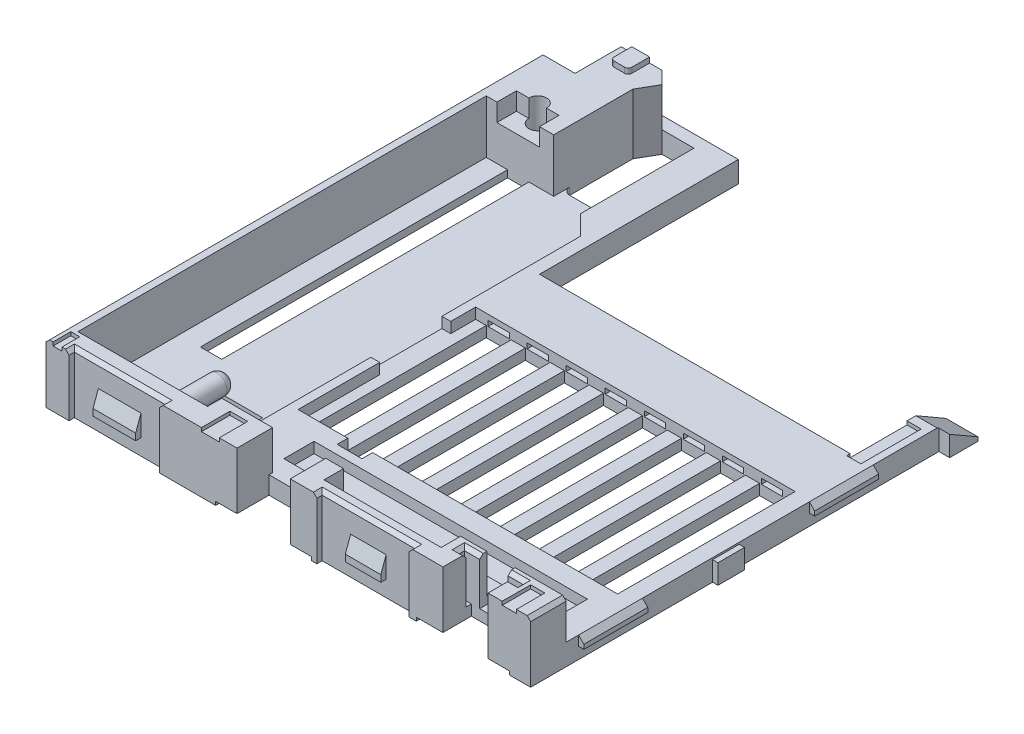
from build123d import *

# Parameters (mm, degrees)
SKETCH1_W                = 13.65
SKETCH1_H                = 15.2
BOSS_EXTRUDE1_DEPTH      = 1.7
CUT_EXTRUDE1_OUTLINE_W   = 1.5
CUT_EXTRUDE1_OUTLINE_H   = 0.9
CUT_EXTRUDE1_OUTLINE_W_2 = 1.27
CUT_EXTRUDE1_OUTLINE_H_2 = 0.8
CUT_EXTRUDE1_OUTLINE_W_3 = 0.9
CUT_EXTRUDE1_OUTLINE_H_3 = 1.3
CUT_EXTRUDE1_OUTLINE_W_4 = 1.4
CUT_EXTRUDE1_OUTLINE_H_4 = 2
CUT_EXTRUDE1_OUTLINE_W_5 = 0.6
CUT_EXTRUDE1_OUTLINE_H_5 = 8.65
CUT_EXTRUDE1_OUTLINE_R   = 0.25
CUT_EXTRUDE1_OUTLINE_W_6 = 0.7
CUT_EXTRUDE1_OUTLINE_H_6 = 5
CUT_EXTRUDE1_OUTLINE_H_7 = 5.3
CUT_EXTRUDE1_DEPTH       = 1.7
SKETCH3_W                = 2.55
SKETCH3_H                = 1.7
CUT_EXTRUDE2_DEPTH       = 0.15
SKETCH4_W                = 2.6
SKETCH4_H                = 1.7
CUT_EXTRUDE3_DEPTH       = 0.15
SKETCH5_W                = 2.7
SKETCH5_H                = 1.4
SKETCH5_W_2              = 2.62
SKETCH5_W_3              = 2.6
SKETCH5_H_2              = 0.95
CUT_EXTRUDE4_DEPTH       = 0.1
SKETCH6_W                = 1
SKETCH6_H                = 0.95
CUT_EXTRUDE5_DEPTH       = 0.2
SKETCH7_W                = 1.9
SKETCH7_H                = 1.8
CUT_EXTRUDE6_DEPTH       = 0.1
SKETCH8_W                = 0.5
SKETCH8_H                = 1.2
CUT_EXTRUDE7_DEPTH       = 1
CUT_EXTRUDE8_DEPTH       = 1.5
CUT_EXTRUDE9_DEPTH       = 1.1
SKETCH11_W               = 9
SKETCH11_H               = 5
CUT_EXTRUDE10_DEPTH      = 0.3
SKETCH12_W               = 1.2
SKETCH12_H               = 0.55
CUT_EXTRUDE11_DEPTH      = 0.5
SKETCH14_W               = 7.7
SKETCH14_H               = 0.85
CUT_EXTRUDE12_DEPTH      = 0.3
SKETCH15_W               = 0.8
SKETCH15_H               = 0.7
CUT_EXTRUDE13_DEPTH      = 1.3
SKETCH16_W               = 1.65
SKETCH16_H               = 0.15
CUT_EXTRUDE14_DEPTH      = 1.3
SKETCH17_W               = 0.4
SKETCH17_H               = 0.8
CUT_EXTRUDE15_DEPTH      = 0.1
SKETCH18_W               = 0.5
SKETCH18_H               = 0.8
CUT_EXTRUDE16_DEPTH      = 0.1
SKETCH19_W               = 0.25
SKETCH19_H               = 0.5
CUT_EXTRUDE17_DEPTH      = 0.1
SKETCH20_W               = 3.3
SKETCH20_H               = 0.55
CUT_EXTRUDE18_DEPTH      = 0.8
SKETCH21_W               = 0.25
SKETCH21_H               = 2
CUT_EXTRUDE19_DEPTH      = 0.3
SKETCH22_W               = 0.4
SKETCH22_H               = 1.7
CUT_EXTRUDE20_DEPTH      = 0.1
SKETCH23_R               = 0.275
BOSS_EXTRUDE3_DEPTH      = 1.5
FILLET3_R                = 0.05
FILLET4_R                = 0.25
SKETCH24_W               = 0.9
SKETCH24_H               = 0.6
BOSS_EXTRUDE4_DEPTH      = 0.8
CHAMFER1_SIZE            = 0.85
CHAMFER1_SIZE2           = 0.490747729
SKETCH25_W               = 1
SKETCH25_H               = 0.6
BOSS_EXTRUDE5_DEPTH      = 0.15
DRAFT1_ANGLE             = 70
SKETCH26_W               = 1.2
SKETCH26_H               = 0.6
BOSS_EXTRUDE6_DEPTH      = 0.15
DRAFT6_ANGLE             = 70
SKETCH27_W               = 1.1
SKETCH27_H               = 0.65
SKETCH27_W_2             = 0.75
SKETCH27_H_2             = 0.6
BOSS_EXTRUDE7_DEPTH      = 0.15
DRAFT3_ANGLE             = 70
SKETCH29_W               = 1.8
SKETCH29_H               = 0.275
BOSS_EXTRUDE8_DEPTH      = 0.15
SKETCH29_W_2             = 0.75
SKETCH29_H_2             = 0.55
BOSS_EXTRUDE8_2_DEPTH    = 0.15
BOSS_EXTRUDE8_3_DEPTH    = 0.15
DRAFT4_ANGLE             = 45
DRAFT5_ANGLE             = 45
BOSS_EXTRUDE9_DEPTH      = 0.15
CHAMFER4_SIZE            = 0.1
SKETCH32_W               = 0.6
SKETCH32_H               = 0.15
CUT_EXTRUDE21_DEPTH      = 1.7
LPATTERN1_COUNT          = 8
LPATTERN1_PITCH          = 1.1


# Read off the part's stored shape, not the designer's step: Cut-Extrude1
with BuildPart() as part:
    # Sketch1 → Boss-Extrude1 (new body)
    with BuildSketch(Plane(origin=(0, 0, 0), x_dir=(1, 0, 0), z_dir=(0, 1, 0))):
        Rectangle(SKETCH1_W, SKETCH1_H)
    extrude(amount=BOSS_EXTRUDE1_DEPTH)

    # Cut-Extrude1 outline → Cut-Extrude1 (cut)
    with BuildSketch(Plane(origin=(0, 0, 0), x_dir=(1, 0, 0), z_dir=(0, 1, 0))):
        with Locations((-0.695, -7.15)):
            Rectangle(CUT_EXTRUDE1_OUTLINE_W, CUT_EXTRUDE1_OUTLINE_H)
        with Locations((4.99, -7.2)):
            Rectangle(CUT_EXTRUDE1_OUTLINE_W_2, CUT_EXTRUDE1_OUTLINE_H_2)
        with Locations((-6.375, 6.95)):
            Rectangle(CUT_EXTRUDE1_OUTLINE_W_3, CUT_EXTRUDE1_OUTLINE_H_3)
        Polygon((6.225, 3.9), (6.825, 3.9), (6.825, 7.6), (-2.525, 7.6), (-2.525, 2), (6.225, 2), align=None)
        with Locations((-4.025, -6)):
            Rectangle(CUT_EXTRUDE1_OUTLINE_W_4, CUT_EXTRUDE1_OUTLINE_H_4)
        with Locations((-5.625, 0.175)):
            Rectangle(CUT_EXTRUDE1_OUTLINE_W_5, CUT_EXTRUDE1_OUTLINE_H_5)
        with Locations((-5.625, 5.05)):
            Circle(CUT_EXTRUDE1_OUTLINE_R)
        with BuildLine():
            Line((-3.425, 4.95), (-3.425, 7.25))
            Line((-3.425, 7.25), (-4.325, 7.25))
            Line((-4.325, 7.25), (-4.625, 6.730384758))
            Line((-4.625, 6.730384758), (-4.625, 4.95))
            ThreePointArc((-4.625, 4.95), (-4.566421356, 4.808578644), (-4.425, 4.75))
            Line((-4.425, 4.75), (-3.625, 4.75))
            ThreePointArc((-3.625, 4.75), (-3.483578644, 4.808578644), (-3.425, 4.95))
        make_face()
        with Locations((5.725, -2.2)):
            Rectangle(CUT_EXTRUDE1_OUTLINE_W_6, CUT_EXTRUDE1_OUTLINE_H_6)
        with Locations((4.625, -2.2)):
            Rectangle(CUT_EXTRUDE1_OUTLINE_W_6, CUT_EXTRUDE1_OUTLINE_H_6)
        with Locations((-0.875, -2.35)):
            Rectangle(CUT_EXTRUDE1_OUTLINE_W_6, CUT_EXTRUDE1_OUTLINE_H_7)
        with Locations((3.525, -2.2)):
            Rectangle(CUT_EXTRUDE1_OUTLINE_W_6, CUT_EXTRUDE1_OUTLINE_H_6)
        with Locations((2.425, -2.2)):
            Rectangle(CUT_EXTRUDE1_OUTLINE_W_6, CUT_EXTRUDE1_OUTLINE_H_6)
        with Locations((1.325, -2.2)):
            Rectangle(CUT_EXTRUDE1_OUTLINE_W_6, CUT_EXTRUDE1_OUTLINE_H_6)
        with Locations((0.225, -2.2)):
            Rectangle(CUT_EXTRUDE1_OUTLINE_W_6, CUT_EXTRUDE1_OUTLINE_H_6)
        with Locations((-1.975, -2.2)):
            Rectangle(CUT_EXTRUDE1_OUTLINE_W_6, CUT_EXTRUDE1_OUTLINE_H_6)
    extrude(amount=CUT_EXTRUDE1_DEPTH, mode=Mode.SUBTRACT)

    # Sketch3 → Cut-Extrude2 (cut)
    with BuildSketch(Plane.XY.offset(7.6)):
        with Locations((-4.9, 0.85)):
            Rectangle(SKETCH3_W, SKETCH3_H)
    extrude(amount=-CUT_EXTRUDE2_DEPTH, mode=Mode.SUBTRACT)

    # Sketch4 → Cut-Extrude3 (cut)
    with BuildSketch(Plane.XY.offset(7.6)):
        with Locations((2.105, 0.85)):
            Rectangle(SKETCH4_W, SKETCH4_H)
    extrude(amount=-CUT_EXTRUDE3_DEPTH, mode=Mode.SUBTRACT)

    # Sketch5 → Cut-Extrude4 (cut)
    with BuildSketch(Plane.XZ):
        with Locations((-0.695, 6.9)):
            Rectangle(SKETCH5_W, SKETCH5_H)
        with Locations((4.915, 6.9)):
            Rectangle(SKETCH5_W_2, SKETCH5_H)
        with Locations((2.105, 6.675)):
            Rectangle(SKETCH5_W_3, SKETCH5_H_2)
    extrude(amount=-CUT_EXTRUDE4_DEPTH, mode=Mode.SUBTRACT)

    # Sketch6 → Cut-Extrude5 (cut)
    with BuildSketch(Plane.XZ.offset(-0.1)):
        with Locations((2.105, 6.675)):
            Rectangle(SKETCH6_W, SKETCH6_H)
    extrude(amount=-CUT_EXTRUDE5_DEPTH, mode=Mode.SUBTRACT)

    # Sketch7 → Cut-Extrude6 (cut)
    with BuildSketch(Plane.XZ):
        with Locations((-5.875, -6.7)):
            Rectangle(SKETCH7_W, SKETCH7_H)
    extrude(amount=-CUT_EXTRUDE6_DEPTH, mode=Mode.SUBTRACT)

    # Sketch8 → Cut-Extrude7 (cut)
    with BuildSketch(Plane.XZ.offset(-0.1)):
        with Locations((-5.375, -6.7)):
            Rectangle(SKETCH8_W, SKETCH8_H)
    extrude(amount=-CUT_EXTRUDE7_DEPTH, mode=Mode.SUBTRACT)

    # Sketch9 → Cut-Extrude8 (cut)
    with BuildSketch(Plane(origin=(0, 1.7, 0), x_dir=(1, 0, 0), z_dir=(0, 1, 0))):
        Polygon((-6.525, 4.5), (-6.525, -7), (-2.875, -7), (-2.875, 3.5), (-3.425, 4.05), (-3.425, 7.25), (-4.325, 7.25), (-4.625, 6.730384758), (-4.625, 4.5), align=None)
    extrude(amount=-CUT_EXTRUDE8_DEPTH, mode=Mode.SUBTRACT)

    # Sketch10 → Cut-Extrude9 (cut)
    with BuildSketch(Plane(origin=(0, 1.7, 0), x_dir=(1, 0, 0), z_dir=(0, 1, 0))):
        Polygon((6.825, -6.6), (0.055, -6.6), (0.055, -6.7), (-1.445, -6.7), (-1.445, -6.6), (-2.875, -6.6), (-2.875, 3.5), (-3.425, 4.05), (-3.425, 7.25), (-4.325, 7.25), (-4.675, 7.6), (6.825, 7.6), align=None)
    extrude(amount=-CUT_EXTRUDE9_DEPTH, mode=Mode.SUBTRACT)

    # Sketch11 → Cut-Extrude10 (cut)
    with BuildSketch(Plane(origin=(0, 0.6, 0), x_dir=(1, 0, 0), z_dir=(0, 1, 0))):
        with Locations((1.875, -2.2)):
            Rectangle(SKETCH11_W, SKETCH11_H)
    extrude(amount=-CUT_EXTRUDE10_DEPTH, mode=Mode.SUBTRACT)

    # Sketch12 → Cut-Extrude11 (cut)
    with BuildSketch(Plane(origin=(0, 1.7, 0), x_dir=(1, 0, 0), z_dir=(0, 1, 0))):
        with Locations((-5.625, 4.775)):
            Rectangle(SKETCH12_W, SKETCH12_H)
    extrude(amount=-CUT_EXTRUDE11_DEPTH, mode=Mode.SUBTRACT)

    # Sketch14 → Cut-Extrude12 (cut)
    with BuildSketch(Plane(origin=(0, 0.6, 0), x_dir=(1, 0, 0), z_dir=(0, 1, 0))):
        with Locations((2.225, -5.675)):
            Rectangle(SKETCH14_W, SKETCH14_H)
    extrude(amount=-CUT_EXTRUDE12_DEPTH, mode=Mode.SUBTRACT)

    # Sketch15 → Cut-Extrude13 (cut)
    with BuildSketch(Plane(origin=(0, 1.7, 0), x_dir=(1, 0, 0), z_dir=(0, 1, 0))):
        with Locations((4.99, -6.45)):
            Rectangle(SKETCH15_W, SKETCH15_H)
    extrude(amount=-CUT_EXTRUDE13_DEPTH, mode=Mode.SUBTRACT)

    # Sketch16 → Cut-Extrude14 (cut)
    with BuildSketch(Plane(origin=(0, 1.7, 0), x_dir=(1, 0, 0), z_dir=(0, 1, 0))):
        with Locations((4.99, -6.875)):
            Rectangle(SKETCH16_W, SKETCH16_H)
    extrude(amount=-CUT_EXTRUDE14_DEPTH, mode=Mode.SUBTRACT)

    # Sketch17 → Cut-Extrude15 (cut)
    with BuildSketch(Plane(origin=(0, 1.7, 0), x_dir=(1, 0, 0), z_dir=(0, 1, 0))):
        with Locations((6.225, -7.2)):
            Rectangle(SKETCH17_W, SKETCH17_H)
    extrude(amount=-CUT_EXTRUDE15_DEPTH, mode=Mode.SUBTRACT)

    # Sketch18 → Cut-Extrude16 (cut)
    with BuildSketch(Plane(origin=(0, 1.7, 0), x_dir=(1, 0, 0), z_dir=(0, 1, 0))):
        with Locations((-2.195, -7.2)):
            Rectangle(SKETCH18_W, SKETCH18_H)
    extrude(amount=-CUT_EXTRUDE16_DEPTH, mode=Mode.SUBTRACT)

    # Sketch19 → Cut-Extrude17 (cut)
    with BuildSketch(Plane(origin=(0, 1.7, 0), x_dir=(1, 0, 0), z_dir=(0, 1, 0))):
        with Locations((-6.5, -7.35)):
            Rectangle(SKETCH19_W, SKETCH19_H)
    extrude(amount=-CUT_EXTRUDE17_DEPTH, mode=Mode.SUBTRACT)

    # Sketch20 → Cut-Extrude18 (cut)
    with BuildSketch(Plane(origin=(0, 1.7, 0), x_dir=(1, 0, 0), z_dir=(0, 1, 0))):
        with Locations((2.205, -6.875)):
            Rectangle(SKETCH20_W, SKETCH20_H)
    extrude(amount=-CUT_EXTRUDE18_DEPTH, mode=Mode.SUBTRACT)

    # Sketch21 → Cut-Extrude19 (cut)
    with BuildSketch(Plane(origin=(0, 0.6, 0), x_dir=(1, 0, 0), z_dir=(0, 1, 0))):
        with Locations((-2.75, -1.4)):
            Rectangle(SKETCH21_W, SKETCH21_H)
    extrude(amount=-CUT_EXTRUDE19_DEPTH, mode=Mode.SUBTRACT)

    # Sketch22 → Cut-Extrude20 (cut)
    with BuildSketch(Plane(origin=(0, 0.6, 0), x_dir=(1, 0, 0), z_dir=(0, 1, 0))):
        with Locations((6.425, 2.75)):
            Rectangle(SKETCH22_W, SKETCH22_H)
    extrude(amount=-CUT_EXTRUDE20_DEPTH, mode=Mode.SUBTRACT)

    # Sketch23 → Boss-Extrude3 (add)
    with BuildSketch(Plane(origin=(0, 0, 7), x_dir=(-1, 0, 0), z_dir=(0, 0, -1))):
        with Locations(Location((3.85, 1.125, 0), (0, 0, 180))):
            Circle(SKETCH23_R)
    extrude(amount=BOSS_EXTRUDE3_DEPTH)

    # Fillet3
    fillet3_edges = [part.edges().sort_by_distance(p)[0] for p in [
        (-4.125, 1.125, 7),
    ]]
    fillet(fillet3_edges, radius=FILLET3_R)

    # Fillet4
    fillet4_edges = [part.edges().sort_by_distance(p)[0] for p in [
        (-4.125, 1.125, 5.5),
    ]]
    fillet(fillet4_edges, radius=FILLET4_R)

    # Sketch24 → Boss-Extrude4 (add)
    with BuildSketch(Plane(origin=(0, 0, -3.9), x_dir=(-1, 0, 0), z_dir=(0, 0, -1))):
        with Locations((-6.675, 0.3)):
            Rectangle(SKETCH24_W, SKETCH24_H)
    extrude(amount=BOSS_EXTRUDE4_DEPTH)

    # Chamfer1
    chamfer1_edges = [part.edges().sort_by_distance(p)[0] for p in [
        (6.675, 0.6, -4.7),
    ]]
    chamfer1_side = [part.faces().sort_by_distance(p)[0] for p in [
        (6.410399569, 0.6, -4.15),
    ]]
    chamfer(chamfer1_edges, length=CHAMFER1_SIZE, length2=CHAMFER1_SIZE2, reference=chamfer1_side[0])

    # Sketch25 → Boss-Extrude5 (add)
    with BuildSketch(Plane.XY.offset(7.45)):
        with Locations((2.105, 0.75)):
            Rectangle(SKETCH25_W, SKETCH25_H)
    extrude(amount=BOSS_EXTRUDE5_DEPTH)

    # Draft1
    draft1_faces = [part.faces().sort_by_distance(p)[0] for p in [
        (2.105, 1.05, 7.525),
    ]]
    draft(draft1_faces, Plane.XY.offset(7.45), DRAFT1_ANGLE)

    # Sketch26 → Boss-Extrude6 (add)
    with BuildSketch(Plane.XY.offset(7.45)):
        with Locations((-4.9, 0.75)):
            Rectangle(SKETCH26_W, SKETCH26_H)
    extrude(amount=BOSS_EXTRUDE6_DEPTH)

    # Draft6
    draft6_faces = [part.faces().sort_by_distance(p)[0] for p in [
        (-4.9, 1.05, 7.525),
    ]]
    draft(draft6_faces, Plane.XY.offset(7.45), DRAFT6_ANGLE)

    # Sketch27 → Boss-Extrude7 (add)
    with BuildSketch(Plane.ZY.offset(6.825)):
        with Locations((4.65, 0.725)):
            Rectangle(SKETCH27_W, SKETCH27_H)
        with Locations((2.1, 0.3)):
            Rectangle(SKETCH27_W_2, SKETCH27_H_2)
        with Locations((-0.4, 0.725)):
            Rectangle(SKETCH27_W, SKETCH27_H)
        with Locations((-4.4, 0.725)):
            Rectangle(SKETCH27_W, SKETCH27_H)
    extrude(amount=BOSS_EXTRUDE7_DEPTH)

    # Draft3
    draft3_faces = [part.faces().sort_by_distance(p)[0] for p in [
        (-6.9, 1.05, -4.4),
        (-6.9, 1.05, -0.4),
        (-6.9, 1.05, 4.65),
    ]]
    draft(draft3_faces, Plane(origin=(-6.825, 1.7, -7.6), x_dir=(0, 0, -1), z_dir=(-1, 0, 0)), DRAFT3_ANGLE)

    # Sketch30 → Boss-Extrude9 (add)
    with BuildSketch(Plane(origin=(0, 1.7, 0), x_dir=(1, 0, 0), z_dir=(0, 1, 0))):
        with BuildLine():
            Line((-5.425, 7), (-5.125, 7))
            ThreePointArc((-5.125, 7), (-5.054289322, 7.029289322), (-5.025, 7.1))
            Line((-5.025, 7.1), (-5.025, 7.6))
            Line((-5.025, 7.6), (-5.525, 7.6))
            Line((-5.525, 7.6), (-5.525, 7.1))
            ThreePointArc((-5.525, 7.1), (-5.495710678, 7.029289322), (-5.425, 7))
        make_face()
    extrude(amount=BOSS_EXTRUDE9_DEPTH)

    # Chamfer4
    chamfer4_edges = [part.edges().sort_by_distance(p)[0] for p in [
        (5.6025, 1.7, 6.8),
        (-4.9, 1.7, 7.45),
        (-6.175, 1.7, 7.525),
        (-3.625, 1.7, 7.525),
        (2.105, 1.7, 7.45),
        (0.805, 1.7, 7.525),
        (3.405, 1.7, 7.525),
        (6.825, 1.7, 7.1),
        (-6.825, 1.7, 0.65),
        (-5.925, 1.7, -6.95),
        (4.3775, 1.7, 6.8),
        (5.72, 1.7, 6.95),
        (5.815, 1.7, 6.875),
        (4.26, 1.7, 6.95),
        (4.165, 1.7, 6.875),
    ]]
    chamfer(chamfer4_edges, length=CHAMFER4_SIZE)

    # Sketch32 → Cut-Extrude21 (cut)
    with BuildSketch(Plane.XY.offset(-0.3)):
        with Locations((-1.975, 0.375)):
            Rectangle(SKETCH32_W, SKETCH32_H)
    cut_extrude21 = extrude(amount=-CUT_EXTRUDE21_DEPTH, mode=Mode.SUBTRACT)

    # LPattern1: Cut-Extrude21 ×8
    with Locations(*[(i * LPATTERN1_PITCH, 0, 0) for i in range(1, LPATTERN1_COUNT)]):
        add(cut_extrude21, mode=Mode.SUBTRACT)


with BuildPart() as body_2:
    # Sketch29 → Boss-Extrude8 (new body)
    with BuildSketch(Plane(origin=(6.825, 0, 0), x_dir=(0, 0, -1), z_dir=(1, 0, 0))):
        with Locations((-5.35, 0.4625)):
            Rectangle(SKETCH29_W, SKETCH29_H)
    extrude(amount=BOSS_EXTRUDE8_DEPTH)

    # Draft4
    draft4_faces = [body_2.faces().sort_by_distance(p)[0] for p in [
        (6.9, 0.6, 5.35),
    ]]
    draft(draft4_faces, Plane(origin=(6.825, 1.7, -7.6), x_dir=(0, 0, 1), z_dir=(1, 0, 0)), DRAFT4_ANGLE)


with BuildPart() as body_3:
    # Sketch29 → Boss-Extrude8 2 (new body)
    with BuildSketch(Plane(origin=(6.825, 0, 0), x_dir=(0, 0, -1), z_dir=(1, 0, 0))):
        with Locations((-2.1, 0.275)):
            Rectangle(SKETCH29_W_2, SKETCH29_H_2)
    extrude(amount=BOSS_EXTRUDE8_2_DEPTH)


with BuildPart() as body_4:
    # Sketch29 → Boss-Extrude8 3 (new body)
    with BuildSketch(Plane(origin=(6.825, 0, 0), x_dir=(0, 0, -1), z_dir=(1, 0, 0))):
        with Locations((1.15, 0.4625)):
            Rectangle(SKETCH29_W, SKETCH29_H)
    extrude(amount=BOSS_EXTRUDE8_3_DEPTH)

    # Draft5
    draft5_faces = [body_4.faces().sort_by_distance(p)[0] for p in [
        (6.9, 0.6, -1.15),
    ]]
    draft(draft5_faces, Plane(origin=(6.825, 1.7, -7.6), x_dir=(0, 0, 1), z_dir=(1, 0, 0)), DRAFT5_ANGLE)


solid = Compound([part.part, body_2.part, body_3.part, body_4.part])
